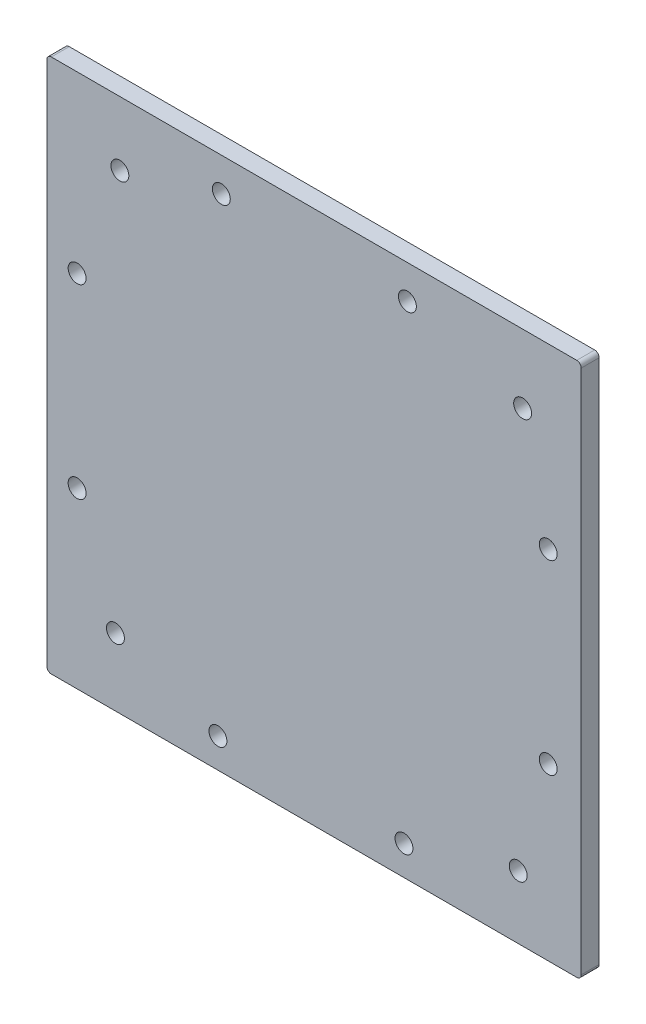
from build123d import *

# Parameters (mm, degrees)
BOSS_EXTRUDE1_DEPTH = 3.175
CUT_EXTRUDE2_REACH  = 69.068
SKETCH3_R           = 1.5875


with BuildPart() as part:
    # Sketch1 → Boss-Extrude1 (new body)
    with BuildSketch(Plane.XY):
        with BuildLine():
            Line((46.57725, -47.371), (-46.57725, -47.371))
            ThreePointArc((-46.57725, -47.371), (-47.138516008, -47.138516008), (-47.371, -46.57725))
            Line((-47.371, -46.57725), (-47.371, 46.57725))
            ThreePointArc((-47.371, 46.57725), (-47.138516008, 47.138516008), (-46.57725, 47.371))
            Line((-46.57725, 47.371), (46.57725, 47.371))
            ThreePointArc((46.57725, 47.371), (47.138516008, 47.138516008), (47.371, 46.57725))
            Line((47.371, 46.57725), (47.371, -46.57725))
            ThreePointArc((47.371, -46.57725), (47.138516008, -47.138516008), (46.57725, -47.371))
        make_face()
    extrude(amount=BOSS_EXTRUDE1_DEPTH)

    # Sketch3 → Cut-Extrude2 (cut, up to next)
    with BuildSketch(Plane.XY.offset(3.175), mode=Mode.PRIVATE) as cut_extrude2_sk1:
        with Locations((15.94531764, -42.114887938)):
            Circle(SKETCH3_R)
    cut_extrude2_tool1 = extrude(cut_extrude2_sk1.sketch, amount=-CUT_EXTRUDE2_REACH, mode=Mode.PRIVATE) & part.part
    # Sketch3 → Cut-Extrude2 (cut, up to next)
    with BuildSketch(Plane.XY.offset(3.175), mode=Mode.PRIVATE) as cut_extrude2_sk2:
        with Locations((36.193055682, -36.193055682)):
            Circle(SKETCH3_R)
    cut_extrude2_tool2 = extrude(cut_extrude2_sk2.sketch, amount=-CUT_EXTRUDE2_REACH, mode=Mode.PRIVATE) & part.part
    # Sketch3 → Cut-Extrude2 (cut, up to next)
    with BuildSketch(Plane.XY.offset(3.175), mode=Mode.PRIVATE) as cut_extrude2_sk3:
        with Locations((41.514353375, -17.146386765)):
            Circle(SKETCH3_R)
    cut_extrude2_tool3 = extrude(cut_extrude2_sk3.sketch, amount=-CUT_EXTRUDE2_REACH, mode=Mode.PRIVATE) & part.part
    # Sketch3 → Cut-Extrude2 (cut, up to next)
    with BuildSketch(Plane.XY.offset(3.175), mode=Mode.PRIVATE) as cut_extrude2_sk4:
        with Locations((41.514353375, 15.838093967)):
            Circle(SKETCH3_R)
    cut_extrude2_tool4 = extrude(cut_extrude2_sk4.sketch, amount=-CUT_EXTRUDE2_REACH, mode=Mode.PRIVATE) & part.part
    # Sketch3 → Cut-Extrude2 (cut, up to next)
    with BuildSketch(Plane.XY.offset(3.175), mode=Mode.PRIVATE) as cut_extrude2_sk5:
        with Locations((36.979577439, 35.209373034)):
            Circle(SKETCH3_R)
    cut_extrude2_tool5 = extrude(cut_extrude2_sk5.sketch, amount=-CUT_EXTRUDE2_REACH, mode=Mode.PRIVATE) & part.part
    # Sketch3 → Cut-Extrude2 (cut, up to next)
    with BuildSketch(Plane.XY.offset(3.175), mode=Mode.PRIVATE) as cut_extrude2_sk6:
        with Locations((16.545852203, 41.407129702)):
            Circle(SKETCH3_R)
    cut_extrude2_tool6 = extrude(cut_extrude2_sk6.sketch, amount=-CUT_EXTRUDE2_REACH, mode=Mode.PRIVATE) & part.part
    # Sketch3 → Cut-Extrude2 (cut, up to next)
    with BuildSketch(Plane.XY.offset(3.175), mode=Mode.PRIVATE) as cut_extrude2_sk7:
        with Locations((-16.43862853, 41.407129702)):
            Circle(SKETCH3_R)
    cut_extrude2_tool7 = extrude(cut_extrude2_sk7.sketch, amount=-CUT_EXTRUDE2_REACH, mode=Mode.PRIVATE) & part.part
    # Sketch3 → Cut-Extrude2 (cut, up to next)
    with BuildSketch(Plane.XY.offset(3.175), mode=Mode.PRIVATE) as cut_extrude2_sk8:
        with Locations((-34.422851278, 35.995894791)):
            Circle(SKETCH3_R)
    cut_extrude2_tool8 = extrude(cut_extrude2_sk8.sketch, amount=-CUT_EXTRUDE2_REACH, mode=Mode.PRIVATE) & part.part
    # Sketch3 → Cut-Extrude2 (cut, up to next)
    with BuildSketch(Plane.XY.offset(3.175), mode=Mode.PRIVATE) as cut_extrude2_sk9:
        with Locations((-42.007664265, 16.43862853)):
            Circle(SKETCH3_R)
    cut_extrude2_tool9 = extrude(cut_extrude2_sk9.sketch, amount=-CUT_EXTRUDE2_REACH, mode=Mode.PRIVATE) & part.part
    # Sketch3 → Cut-Extrude2 (cut, up to next)
    with BuildSketch(Plane.XY.offset(3.175), mode=Mode.PRIVATE) as cut_extrude2_sk10:
        with Locations((-42.007664265, -16.545852203)):
            Circle(SKETCH3_R)
    cut_extrude2_tool10 = extrude(cut_extrude2_sk10.sketch, amount=-CUT_EXTRUDE2_REACH, mode=Mode.PRIVATE) & part.part
    # Sketch3 → Cut-Extrude2 (cut, up to next)
    with BuildSketch(Plane.XY.offset(3.175), mode=Mode.PRIVATE) as cut_extrude2_sk11:
        with Locations((-17.039163093, -42.114887938)):
            Circle(SKETCH3_R)
    cut_extrude2_tool11 = extrude(cut_extrude2_sk11.sketch, amount=-CUT_EXTRUDE2_REACH, mode=Mode.PRIVATE) & part.part
    # Sketch3 → Cut-Extrude2 (cut, up to next)
    with BuildSketch(Plane.XY.offset(3.175), mode=Mode.PRIVATE) as cut_extrude2_sk12:
        with Locations((-35.209373034, -35.406533926)):
            Circle(SKETCH3_R)
    cut_extrude2_tool12 = extrude(cut_extrude2_sk12.sketch, amount=-CUT_EXTRUDE2_REACH, mode=Mode.PRIVATE) & part.part
    add(cut_extrude2_tool1.solids().sort_by_distance((15.945318, -42.114888, 3.175))[0], mode=Mode.SUBTRACT)
    add(cut_extrude2_tool2.solids().sort_by_distance((36.193056, -36.193056, 3.175))[0], mode=Mode.SUBTRACT)
    add(cut_extrude2_tool3.solids().sort_by_distance((41.514353, -17.146387, 3.175))[0], mode=Mode.SUBTRACT)
    add(cut_extrude2_tool4.solids().sort_by_distance((41.514353, 15.838094, 3.175))[0], mode=Mode.SUBTRACT)
    add(cut_extrude2_tool5.solids().sort_by_distance((36.979577, 35.209373, 3.175))[0], mode=Mode.SUBTRACT)
    add(cut_extrude2_tool6.solids().sort_by_distance((16.545852, 41.40713, 3.175))[0], mode=Mode.SUBTRACT)
    add(cut_extrude2_tool7.solids().sort_by_distance((-16.438629, 41.40713, 3.175))[0], mode=Mode.SUBTRACT)
    add(cut_extrude2_tool8.solids().sort_by_distance((-34.422851, 35.995895, 3.175))[0], mode=Mode.SUBTRACT)
    add(cut_extrude2_tool9.solids().sort_by_distance((-42.007664, 16.438629, 3.175))[0], mode=Mode.SUBTRACT)
    add(cut_extrude2_tool10.solids().sort_by_distance((-42.007664, -16.545852, 3.175))[0], mode=Mode.SUBTRACT)
    add(cut_extrude2_tool11.solids().sort_by_distance((-17.039163, -42.114888, 3.175))[0], mode=Mode.SUBTRACT)
    add(cut_extrude2_tool12.solids().sort_by_distance((-35.209373, -35.406534, 3.175))[0], mode=Mode.SUBTRACT)


solid = part.part
